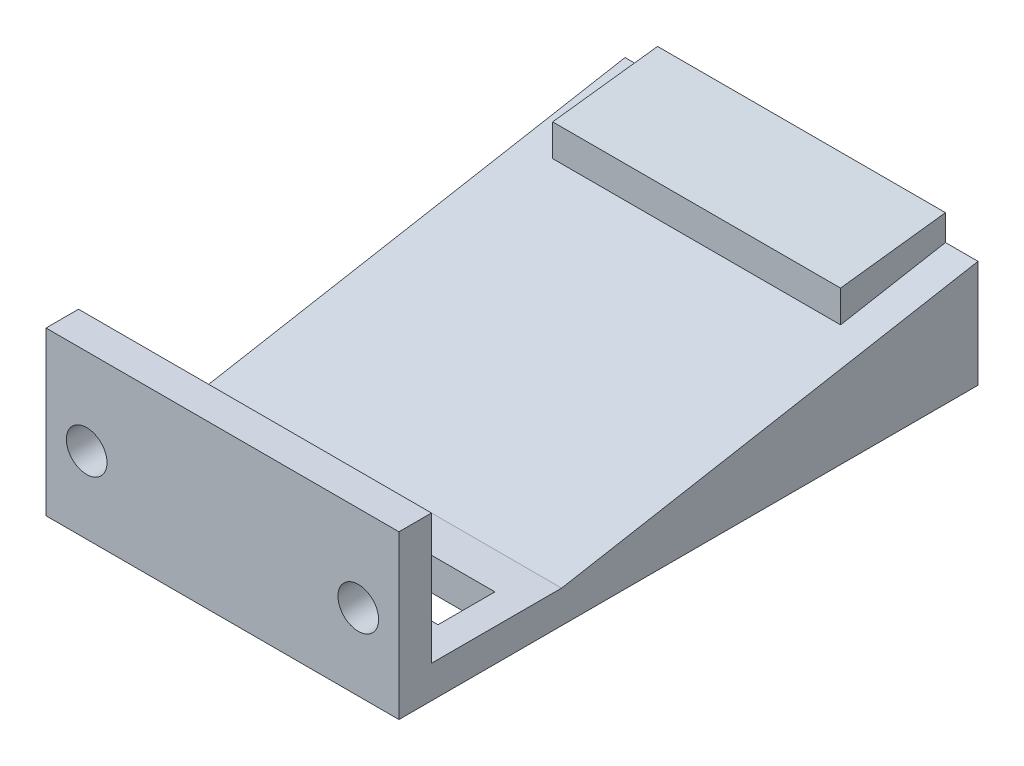
from build123d import *

# Parameters (mm, degrees)
SKETCH1_W                 = 21.7
SKETCH1_H                 = 33.6
BOSS_EXTRUDE1_DEPTH       = 3
SKETCH2_W                 = 18
SKETCH2_H                 = 3.5
CUT_EXTRUDE1_DEPTH        = 2
BOSS_EXTRUDE2_DEPTH       = 21.7
SKETCH4_W                 = 17.7
SKETCH4_H                 = 6.45
BOSS_EXTRUDE3_DEPTH       = 9.2
SKETCH5_W                 = 21.7
SKETCH5_H                 = 2
BOSS_EXTRUDE4_DEPTH       = 11
F_1_0MM_DOWEL_HOLE1_D     = 2.5
F_1_0MM_DOWEL_HOLE1_DEPTH = 9.248924226
F_1_0MM_DOWEL_HOLE1_TIP   = 0.751075774
CHAMFER1_SIZE             = 6.515477142
CHAMFER1_SIZE_2           = 0.8
CUT_EXTRUDE2_DEPTH        = 25.334389246
CUT_EXTRUDE2_DEPTH_BACK   = 1
SKETCH8_W                 = 21.7
SKETCH8_H                 = 35.6


with BuildPart() as part:
    # Sketch1 → Boss-Extrude1 (new body)
    with BuildSketch(Plane(origin=(0, 0, 0), x_dir=(1, 0, 0), z_dir=(0, 1, 0))):
        Rectangle(SKETCH1_W, SKETCH1_H)
    extrude(amount=BOSS_EXTRUDE1_DEPTH)

    # Sketch2 → Cut-Extrude1 (cut)
    with BuildSketch(Plane(origin=(0, 3, 0), x_dir=(1, 0, 0), z_dir=(0, 1, 0))):
        with Locations((0, -12.8)):
            Rectangle(SKETCH2_W, SKETCH2_H)
    extrude(amount=-CUT_EXTRUDE1_DEPTH, mode=Mode.SUBTRACT)

    # Sketch3 → Boss-Extrude2 (add)
    with BuildSketch(Plane(origin=(10.85, 0, 0), x_dir=(0, 0, -1), z_dir=(1, 0, 0))):
        Polygon((-8.8, 3), (16.8, 7.6), (16.8, 3), align=None)
    extrude(amount=-BOSS_EXTRUDE2_DEPTH)

    # Sketch4 → Boss-Extrude3 (add)
    with BuildSketch(Plane(origin=(0, 0, 0.27322177), x_dir=(1, 0, 0), z_dir=(0, 1, 0))):
        with Locations((0, 13.84822177)):
            Rectangle(SKETCH4_W, SKETCH4_H)
    extrude(amount=BOSS_EXTRUDE3_DEPTH)

    # Sketch5 → Boss-Extrude4 (add)
    with BuildSketch(Plane(origin=(0, 0, 0), x_dir=(1, 0, 0), z_dir=(0, 1, 0))):
        with Locations((0, -17.8)):
            Rectangle(SKETCH5_W, SKETCH5_H)
    extrude(amount=BOSS_EXTRUDE4_DEPTH)

    # Ø1.0mm Dowel Hole1
    with Locations(Plane.XY.offset(18.8)):
        with Locations((-8.35, 5.7), (8.35, 5.7)):
            Hole(F_1_0MM_DOWEL_HOLE1_D / 2, depth=F_1_0MM_DOWEL_HOLE1_DEPTH)
            with Locations((0, 0, -(F_1_0MM_DOWEL_HOLE1_DEPTH + F_1_0MM_DOWEL_HOLE1_TIP / 2))):  # 118° drill point
                Cone(0, F_1_0MM_DOWEL_HOLE1_D / 2, F_1_0MM_DOWEL_HOLE1_TIP, mode=Mode.SUBTRACT)

    # Chamfer1
    # the kernel refuses this chamfer: 6.515477142, 0.8 mm, written as the material it takes off along each edge
    with BuildSketch(Plane(origin=(25.785570178, 9.2, -10.35), x_dir=(0, 0.00468857506979086, -0.9999890085715017), z_dir=(-1, 0, 0))) as chamfer1_piece_1:
        Polygon((CHAMFER1_SIZE * 0.99998900863, CHAMFER1_SIZE * 0.00468857507006), (-CHAMFER1_SIZE_2 * 0.00468857506979, CHAMFER1_SIZE_2 * 0.999989008572), (0, 0), align=None)
    extrude(amount=51.571140357, mode=Mode.SUBTRACT)

    # Sketch8 → Cut-Extrude2 (cut, two sides: drawn at the far end of the back side and taken through both)
    with BuildSketch(Plane.XZ.offset(-CUT_EXTRUDE2_DEPTH_BACK)):
        with Locations((0, 1)):
            Rectangle(SKETCH8_W, SKETCH8_H)
    extrude(amount=CUT_EXTRUDE2_DEPTH + CUT_EXTRUDE2_DEPTH_BACK, mode=Mode.SUBTRACT)


solid = part.part
